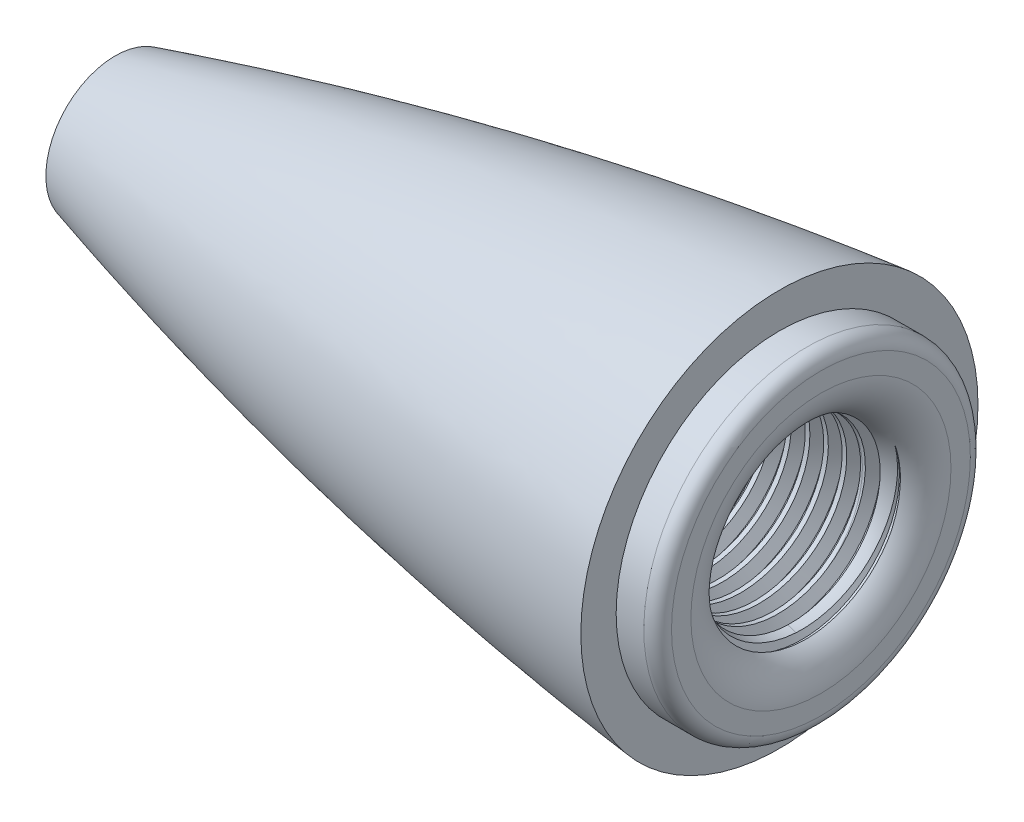
from build123d import *

# Parameters (mm, degrees)
CUT_EXTRUDE1_DEPTH      = 314.252227441
CUT_EXTRUDE1_DEPTH_BACK = 314.252227441
SKETCH6_W               = 101.599999998
SKETCH6_H               = 152.4
THREAD2_PITCH           = 4.233333333
FILLET1_R               = 2.54
FILLET2_R               = 1.778
FILLET3_R               = 2.54
CUT_EXTRUDE2_REACH      = 176.277
SKETCH8_R               = 9.525
FILLET4_R               = 3.175


with BuildPart() as part:
    # Sketch1 → Revolve1 (revolve)
    with BuildSketch(Plane.XY, mode=Mode.PRIVATE) as revolve1_sk:
        with BuildLine():
            Line((304.799999998, 51.107327833), (304.799999998, 42.748185978))
            add(Edge.make_bspline(
                [(25.4, 0.002522764), (56.444444444, 9.729223161), (87.488888888, 18.120731489), (118.533333333, 25.233221093), (149.577777777, 31.10890798), (180.622222221, 35.779437831), (211.666666665, 39.267508626), (242.71111111, 41.587962045), (273.755555554, 42.748176161), (304.799999998, 42.748185978)],
                knots=[0.080493542, 0.080493542, 0.080493542, 0.080493542, 0.080493542, 0.080493542, 0.080493542, 0.080493542, 0.080493542, 0.080493542, 0.916408504, 0.916408504, 0.916408504, 0.916408504, 0.916408504, 0.916408504, 0.916408504, 0.916408504, 0.916408504, 0.916408504], degree=9))
            Line((25.4, 0.002522764), (0, 0.00254))
            add(Edge.make_bspline(
                [(0, 0.00254), (33.866666666, 11.687651304), (67.733333333, 21.738238195), (101.599999999, 30.237694067), (135.466666666, 37.247243775), (169.333333332, 42.81226925), (203.199999999, 46.965033259), (237.066666665, 49.726567414), (270.933333332, 51.107317124), (304.799999998, 51.107327833)],
                knots=[0.079928624, 0.079928624, 0.079928624, 0.079928624, 0.079928624, 0.079928624, 0.079928624, 0.079928624, 0.079928624, 0.079928624, 0.916357148, 0.916357148, 0.916357148, 0.916357148, 0.916357148, 0.916357148, 0.916357148, 0.916357148, 0.916357148, 0.916357148], degree=9))
        make_face()
    revolve(revolve1_sk.sketch.rotate(Axis((0, 0, 0), (-1, 0, 0)), 90), axis=Axis((0, 0, 0), (-1, 0, 0)))

    # Sketch6 → Cut-Extrude1 (cut, two sides: drawn at the far end of the back side and taken through both)
    with BuildSketch(Plane.XY.offset(-CUT_EXTRUDE1_DEPTH_BACK)):
        Polygon((0, 0), (0, 38.1), (50.8, 38.1), (50.8, -38.1), (0, -38.1), align=None)
        with Locations((253.999999999, 0)):
            Rectangle(SKETCH6_W, SKETCH6_H)
    extrude(amount=CUT_EXTRUDE1_DEPTH + CUT_EXTRUDE1_DEPTH_BACK, mode=Mode.SUBTRACT)

    # Sketch5 → Revolve2 (revolve)
    with BuildSketch(Plane.XY, mode=Mode.PRIVATE) as revolve2_sk:
        Polygon((142.875, 19.685), (212.725, 19.685), (212.725, 37.465), (200.66, 37.465), (200.66, 26.035), (152.4, 26.035), (152.4, 32.385), (142.875, 32.385), align=None)
    revolve(revolve2_sk.sketch.rotate(Axis((0, 0, 0), (1, 0, 0)), 180), axis=Axis((0, 0, 0), (1, 0, 0)))

    # Thread2: the profile of Thread Profile2 profile screwed along a right-hand helix of 17.25 turns, 12 arcs to a turn; built about Z, then put on its axis
    thread2_z = Axis((0, 0, 0), (0, 0, 1))
    thread2_corners = [(19.6847, 0, -0.000173205), (21.976358871, 0, 1.322916661), (21.976358871, 0, 1.852083328), (19.6847, 0, 3.175173194)]
    with BuildLine(mode=Mode.PRIVATE) as thread2_profile:
        Line(thread2_corners[0], thread2_corners[1])
        Line(thread2_corners[1], thread2_corners[2])
        Line(thread2_corners[2], thread2_corners[3])
        Line(thread2_corners[3], thread2_corners[0])
    thread2_cap = Face(thread2_profile.wire())
    thread2_turn_angles = [0, 15, 30, 45, 60, 75, 90, 105, 120, 135, 150, 165, 180, 195, 210, 225, 240, 255, 270, 285, 300, 315, 330, 345, 360]
    thread2_turn_weights = [1, 0.9659258262890683, 1, 0.9659258262890683, 1, 0.9659258262890683, 1, 0.9659258262890683, 1, 0.9659258262890683, 1, 0.9659258262890683, 1, 0.9659258262890683, 1, 0.9659258262890683, 1, 0.9659258262890683, 1, 0.9659258262890683, 1, 0.9659258262890683, 1, 0.9659258262890683, 1]
    thread2_turn_rails = [Edge.make_bspline([Vector(p[0], p[1], 0).rotate(thread2_z, thread2_turn_angles[k]) / thread2_turn_weights[k] + Vector(0, 0, p[2] + THREAD2_PITCH * thread2_turn_angles[k] / 360) for k in range(25)], [0, 0, 0, 1, 1, 2, 2, 3, 3, 4, 4, 5, 5, 6, 6, 7, 7, 8, 8, 9, 9, 10, 10, 11, 11, 12, 12, 12], 2, thread2_turn_weights) for p in thread2_corners]
    thread2_turn_sides = [Face.make_surface_from_curves(thread2_turn_rails[p[0]], thread2_turn_rails[p[1]]) for p in [(0, 1), (1, 2), (2, 3), (3, 0)]]
    thread2_last_angles = [6120, 6135, 6150, 6165, 6180, 6195, 6210]
    thread2_last_weights = [1, 0.9659258262890683, 1, 0.9659258262890683, 1, 0.9659258262890642, 1]
    thread2_last_rails = [Edge.make_bspline([Vector(p[0], p[1], 0).rotate(thread2_z, thread2_last_angles[k]) / thread2_last_weights[k] + Vector(0, 0, p[2] + THREAD2_PITCH * thread2_last_angles[k] / 360) for k in range(7)], [0, 0, 0, 1, 1, 2, 2, 3, 3, 3], 2, thread2_last_weights) for p in thread2_corners]
    thread2_last_sides = [Face.make_surface_from_curves(thread2_last_rails[p[0]], thread2_last_rails[p[1]]) for p in [(0, 1), (1, 2), (2, 3), (3, 0)]]
    thread2 = Plane(origin=(139.7, 0, 0), x_dir=(0, 0, -1), z_dir=(1, 0, 0)) * Solid(Shell([*[p.moved(Location((0, 0, THREAD2_PITCH * i))) for i in range(17) for p in thread2_turn_sides], *thread2_last_sides, thread2_cap, thread2_cap.rotate(thread2_z, 6210).moved(Location((0, 0, THREAD2_PITCH * 6210 / 360)))]))
    add(thread2, mode=Mode.SUBTRACT)

    # Fillet1
    fillet1_edges = [part.edges().sort_by_distance(p)[0] for p in [
        (142.875, 1.5e-08, 28.612520002),
    ]]
    fillet(fillet1_edges, radius=FILLET1_R)

    # Fillet2
    fillet2_edges = [part.edges().sort_by_distance(p)[0] for p in [
        (152.4, 26.035, 0),
        (152.4, -2.4e-08, 30.237587294),
    ]]
    fillet(fillet2_edges, radius=FILLET2_R)

    # Fillet3
    fillet3_edges = [part.edges().sort_by_distance(p)[0] for p in [
        (200.66, 1e-09, 36.927403807),
        (200.66, 26.035, 0),
    ]]
    fillet(fillet3_edges, radius=FILLET3_R)

    # Sketch8 → Cut-Extrude2 (cut, up to next)
    with BuildSketch(Plane.ZY.offset(-50.8), mode=Mode.PRIVATE) as cut_extrude2_sk1:
        with Locations(Location((0, 0, 0), (0, 0, 270))):
            Circle(SKETCH8_R)
    cut_extrude2_tool1 = extrude(cut_extrude2_sk1.sketch, amount=-CUT_EXTRUDE2_REACH, mode=Mode.PRIVATE) & part.part
    add(cut_extrude2_tool1.solids().sort_by_distance((50.8, 0, 0))[0], mode=Mode.SUBTRACT)

    # Fillet4
    fillet4_edges = [part.edges().sort_by_distance(p)[0] for p in [
        (212.725, 37.465, 0),
    ]]
    fillet(fillet4_edges, radius=FILLET4_R)

    # Sketch10 → Cut-Revolve1 (revolve, cut)
    with BuildSketch(Plane.XY, mode=Mode.PRIVATE) as cut_revolve1_sk:
        with BuildLine():
            Line((202.565, 19.685), (212.725, 19.685))
            Line((212.725, 19.685), (212.725, 29.845))
            ThreePointArc((212.725, 29.845), (209.749204897, 22.660795103), (202.565, 19.685))
        make_face()
    revolve(cut_revolve1_sk.sketch.rotate(Axis((50.8, 0, 0), (1, 0, 0)), 270), axis=Axis((50.8, 0, 0), (1, 0, 0)), mode=Mode.SUBTRACT)


solid = part.part
